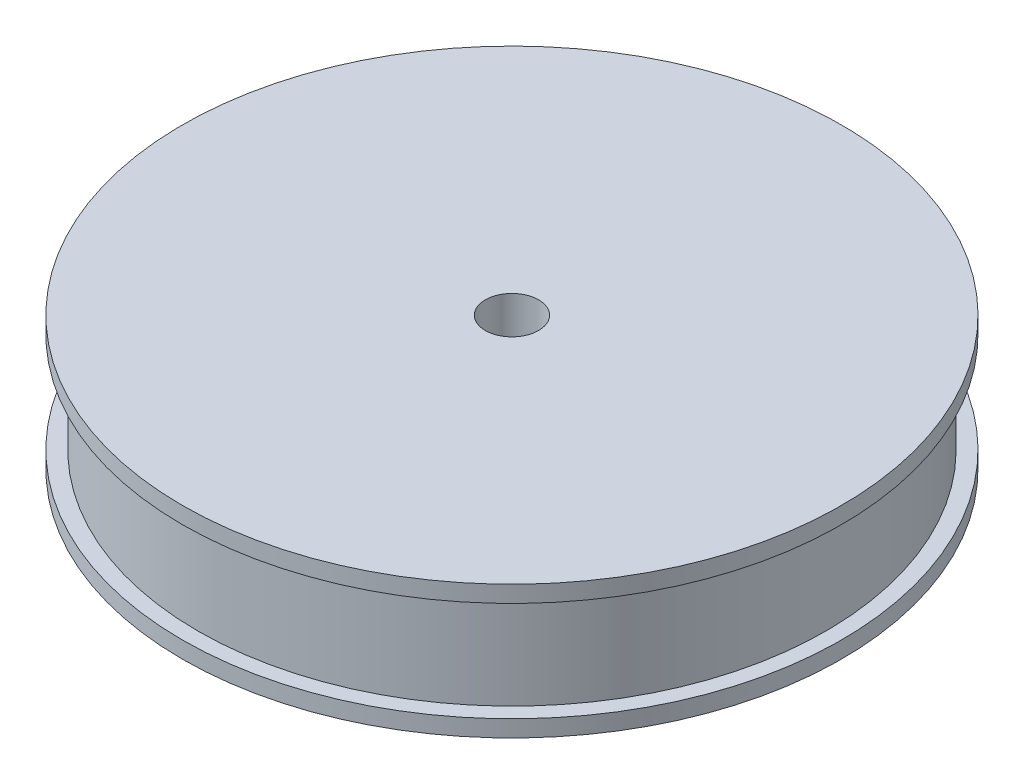
from build123d import *


with BuildPart() as part:
    # Schizzo1 → Rivoluzione1 (revolve)
    with BuildSketch(Plane.XY):
        Polygon((4, -7.661290323), (49.5, -7.661290323), (49.5, -5.161290323), (47.175, -5.161290323), (47.175, 9.838709677), (49.5, 9.838709677), (49.5, 12.338709677), (4, 12.338709677), align=None)
    revolve(axis=Axis((0, 12.338709677, 0), (0, -1, 0)))


solid = part.part
